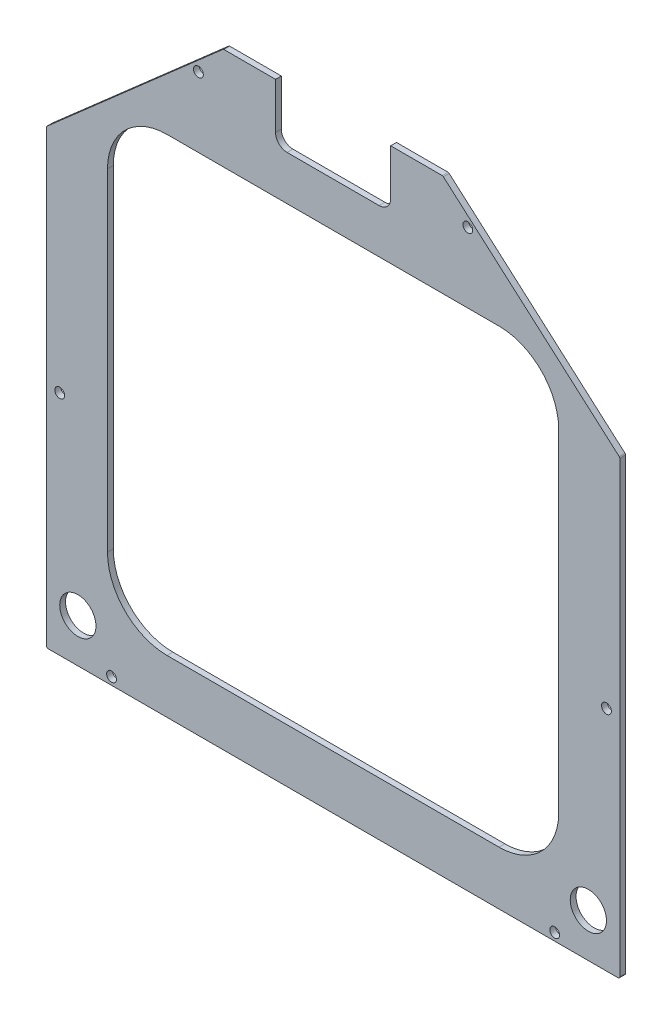
from build123d import *

# Parameters (mm, degrees)
BOSS_EXTRUDE1_DEPTH        = 1.6002
F_2_CLEARANCE_HOLE1_D      = 2.7051
SKETCH8_W                  = 31.75
SKETCH8_H                  = 15.875
CUT_EXTRUDE3_DEPTH         = 189.581025689
FILLET1_R                  = 3.175
F_10_0_10_DIAMETER_HOLE1_D = 10


with BuildPart() as part:
    # Sketch2 → Boss-Extrude1 (new body)
    with BuildSketch(Plane.XY.offset(1.5875)):
        with BuildLine():
            Line((70.711408136, 21.697450137), (10.568555904, 21.697450137))
            ThreePointArc((10.568555904, 21.697450137), (10.389483229, 21.664841533), (10.233399988, 21.571201994))
            Line((10.233399988, 21.571201994), (-38.276423867, -21.017595986))
            ThreePointArc((-38.276423867, -21.017595986), (-38.404043925, -21.189818895), (-38.449267951, -21.399347884))
            Line((-38.449267951, -21.399347884), (-38.449267951, -145.180549937))
            ThreePointArc((-38.449267951, -145.180549937), (-38.300478171, -145.539760241), (-37.941267867, -145.688549937))
            Line((-37.941267867, -145.688549937), (119.221232133, -145.688549937))
            ThreePointArc((119.221232133, -145.688549937), (119.580442454, -145.53976015), (119.729232133, -145.18054983))
            Line((119.729232133, -145.18054983), (119.729232133, -21.399347777))
            ThreePointArc((119.729232133, -21.399347777), (119.684008101, -21.189818753), (119.556387965, -21.017595879))
            Line((119.556387965, -21.017595879), (71.046564052, 21.571202036))
            ThreePointArc((71.046564052, 21.571202036), (70.890480797, 21.664841536), (70.711408136, 21.697450137))
        make_face()
        with BuildLine():
            Line((102.869982113, -114.451909481), (102.869982113, -22.874190224))
            ThreePointArc((102.869982113, -22.874190224), (98.05448357, -11.248548333), (86.428841679, -6.433049852))
            Line((86.428841679, -6.433049852), (-5.148877578, -6.433049852))
            ThreePointArc((-5.148877578, -6.433049852), (-16.774519469, -11.248548395), (-21.59001795, -22.874190286))
            Line((-21.59001795, -22.874190286), (-21.59001795, -114.451909543))
            ThreePointArc((-21.59001795, -114.451909543), (-16.774519407, -126.077551434), (-5.148877516, -130.893049915))
            Line((-5.148877516, -130.893049915), (86.428841741, -130.893049915))
            ThreePointArc((86.428841741, -130.893049915), (98.054483632, -126.077551372), (102.869982113, -114.451909481))
        make_face(mode=Mode.SUBTRACT)
    extrude(amount=BOSS_EXTRUDE1_DEPTH)

    # #2 Clearance Hole1 (through all)
    with Locations(Plane.XY.offset(3.1877)):
        with Locations((3.4816648, 12.855075079), (77.798299252, 12.855075129), (-34.763097208, -82.95054975), (116.04306139, -82.950549647), (101.758732132, -143.593049842), (-20.478767868, -143.593049925)):
            Hole(F_2_CLEARANCE_HOLE1_D / 2)

    # Sketch8 → Cut-Extrude3 (cut, through all)
    with BuildSketch(Plane.XY.offset(3.1877)):
        with Locations((40.63998202, 13.759950137)):
            Rectangle(SKETCH8_W, SKETCH8_H)
    extrude(amount=-CUT_EXTRUDE3_DEPTH, mode=Mode.SUBTRACT)

    # Fillet1
    fillet1_edges = [part.edges().sort_by_distance(p)[0] for p in [
        (56.51498202, 5.822450137, 2.3876),
        (24.76498202, 5.822450137, 2.3876),
    ]]
    fillet(fillet1_edges, radius=FILLET1_R)

    # Ø10.0 (10) Diameter Hole1 (through all)
    with Locations(Plane(origin=(0, 0, 1.5875), x_dir=(-1, 0, 0), z_dir=(0, 0, -1))):
        with Locations((-111.045602766, -133.661649696), (29.765638361, -133.661649887)):
            Hole(F_10_0_10_DIAMETER_HOLE1_D / 2)


solid = part.part
